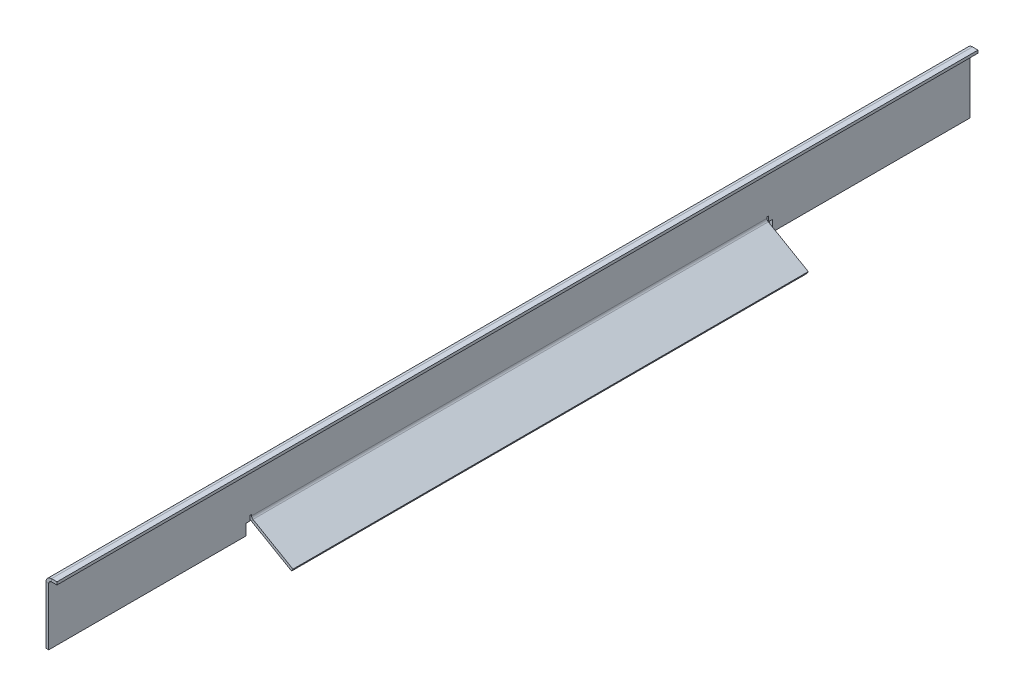
from build123d import *

# Parameters (mm, degrees)
BASE_FLANGE1_DEPTH           = 3.175
EDGE_FLANGE1_START           = -833.4375
EDGE_FLANGE1_DEPTH           = 600.075
EDGE_FLANGE1_2_DEPTH         = 1.5875
EDGE_FLANGE1_START_2         = -234.95
EDGE_FLANGE1_3_DEPTH         = 1.5875
EDGE_FLANGE1_START_3         = -831.85
EDGE_FLANGE1_4_DEPTH         = 596.9
EDGE_FLANGE2_STRIP_W         = 19.05
EDGE_FLANGE2_STRIP_H         = 3.175
EDGE_FLANGE2_STRIP_CUT_DEPTH = 1066.8
EDGE_FLANGE2_DEPTH           = 1066.8


# Read off the part's stored shape, not the designer's step: Edge-Flange1
# Sheet-metal steps are written as plain solids
with BuildPart() as part:
    # Sketch1 → Base-Flange1 (new body)
    with BuildSketch(Plane(origin=(0, 0, 0), x_dir=(0, 0, -1), z_dir=(1, 0, 0))):
        Polygon((838.2, 0), (1066.8, 0), (1066.8, 73.025), (0, 73.025), (0, 0), (228.6, 0), (228.6, 12.7), (234.95, 12.7), (234.95, 11.43), (831.85, 11.43), (831.85, 12.7), (838.2, 12.7), align=None)
    extrude(amount=-BASE_FLANGE1_DEPTH)

    # Edge-Flange1 outline → Edge-Flange1 (cut)
    with BuildSketch(Plane.XY.offset(EDGE_FLANGE1_START)):
        with BuildLine():
            Line((-3.175, 16.929261314), (-3.175, 11.43))
            Line((-3.175, 11.43), (0, 11.43))
            ThreePointArc((0, 11.43), (-2.324261314, 13.754261314), (-3.175, 16.929261314))
        make_face()
    extrude(amount=EDGE_FLANGE1_DEPTH, mode=Mode.SUBTRACT)

    # Edge-Flange1 2 outline → Edge-Flange1 2 (cut)
    with BuildSketch(Plane.XY.offset(EDGE_FLANGE1_START)):
        with BuildLine():
            Line((0, 18.516761314), (-3.175, 18.516761314))
            Line((-3.175, 18.516761314), (-3.175, 16.929261314))
            ThreePointArc((-3.175, 16.929261314), (-2.757968249, 14.665992052), (-1.561649527, 12.7))
            Line((-1.561649527, 12.7), (0, 12.7))
            Line((0, 12.7), (0, 18.516761314))
        make_face()
    extrude(amount=EDGE_FLANGE1_2_DEPTH, mode=Mode.SUBTRACT)

    # Edge-Flange1 3 outline → Edge-Flange1 3 (cut)
    with BuildSketch(Plane.XY.offset(EDGE_FLANGE1_START_2)):
        with BuildLine():
            Line((0, 18.516761314), (-3.175, 18.516761314))
            Line((-3.175, 18.516761314), (-3.175, 16.929261314))
            ThreePointArc((-3.175, 16.929261314), (-2.757968249, 14.665992052), (-1.561649527, 12.7))
            Line((-1.561649527, 12.7), (0, 12.7))
            Line((0, 12.7), (0, 18.516761314))
        make_face()
    extrude(amount=EDGE_FLANGE1_3_DEPTH, mode=Mode.SUBTRACT)

    # Edge-Flange1 4 outline → Edge-Flange1 4 (add)
    with BuildSketch(Plane.XY.offset(EDGE_FLANGE1_START_3)):
        with BuildLine():
            ThreePointArc((1.5875, 14.179630657), (0.425369343, 15.341761314), (0, 16.929261314))
            Line((0, 16.929261314), (0, 11.43))
            Line((0, 11.43), (46.318351826, -15.311912895))
            Line((46.318351826, -15.311912895), (47.905851826, -12.562282238))
            Line((47.905851826, -12.562282238), (1.5875, 14.179630657))
        make_face()
    extrude(amount=EDGE_FLANGE1_4_DEPTH)

    # Edge-Flange2 strip (across the edge) → Edge-Flange2 strip cut (cut)
    with BuildSketch(Plane(origin=(0, 73.025, -1066.8), x_dir=(0, -1, 0), z_dir=(0, 0, 1))):
        with Locations((-3.175, -1.5875)):
            Rectangle(EDGE_FLANGE2_STRIP_W, EDGE_FLANGE2_STRIP_H)
    extrude(amount=EDGE_FLANGE2_STRIP_CUT_DEPTH, mode=Mode.SUBTRACT)

    # Edge-Flange2 section (across the edge) → Edge-Flange2 (add)
    with BuildSketch(Plane(origin=(0, 73.025, -1066.8), x_dir=(0, -1, 0), z_dir=(0, 0, 1))):
        with BuildLine():
            Line((0, 3.175), (0, 9.525))
            Line((0, 9.525), (3.175, 9.525))
            Line((3.175, 9.525), (3.175, 3.175))
            ThreePointArc((3.175, 3.175), (4.10493597, 0.92993597), (6.35, 0))
            Line((6.35, 0), (6.35, -3.175))
            ThreePointArc((6.35, -3.175), (1.859871939, -1.315128061), (0, 3.175))
        make_face()
    extrude(amount=EDGE_FLANGE2_DEPTH)


solid = part.part
